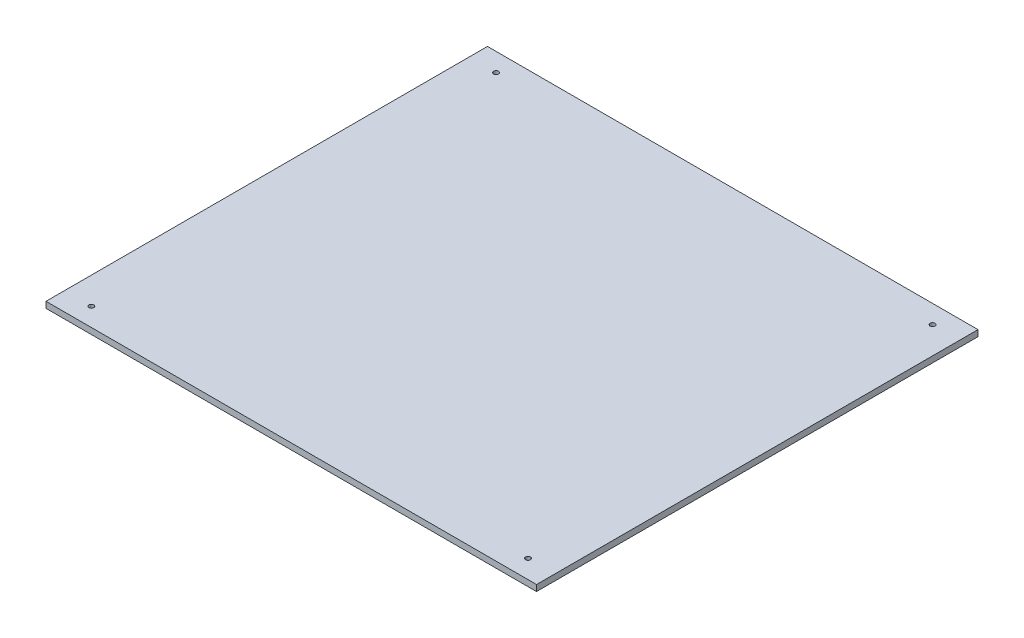
from build123d import *

# Parameters (mm, degrees)
SKETCH2_W            = 400
SKETCH2_H            = 360
BOSS_EXTRUDE1_DEPTH  = 5
SKETCH3_R            = 2
CUT_EXTRUDE1_DEPTH   = 539.168189324
LPATTERN1_COUNT      = 2
LPATTERN1_PITCH      = 330
LPATTERN1_COUNT_DIR2 = 2
LPATTERN1_PITCH_DIR2 = 356


with BuildPart() as part:
    # Sketch2 → Boss-Extrude1 (new body)
    with BuildSketch(Plane(origin=(0, 0, 0), x_dir=(1, 0, 0), z_dir=(0, 1, 0))):
        with Locations((200, 180)):
            Rectangle(SKETCH2_W, SKETCH2_H)
    extrude(amount=BOSS_EXTRUDE1_DEPTH)

    # Sketch3 → Cut-Extrude1 (cut, through all)
    with BuildSketch(Plane(origin=(0, 5, 0), x_dir=(1, 0, 0), z_dir=(0, 1, 0))):
        with Locations((22, 15)):
            Circle(SKETCH3_R)
    cut_extrude1 = extrude(amount=-CUT_EXTRUDE1_DEPTH, mode=Mode.SUBTRACT)

    # LPattern1: Cut-Extrude1 2 × 2
    with Locations(*[(j * LPATTERN1_PITCH_DIR2, 0, -i * LPATTERN1_PITCH) for i in range(LPATTERN1_COUNT) for j in range(LPATTERN1_COUNT_DIR2) if (i, j) != (0, 0)]):
        add(cut_extrude1, mode=Mode.SUBTRACT)


solid = part.part
